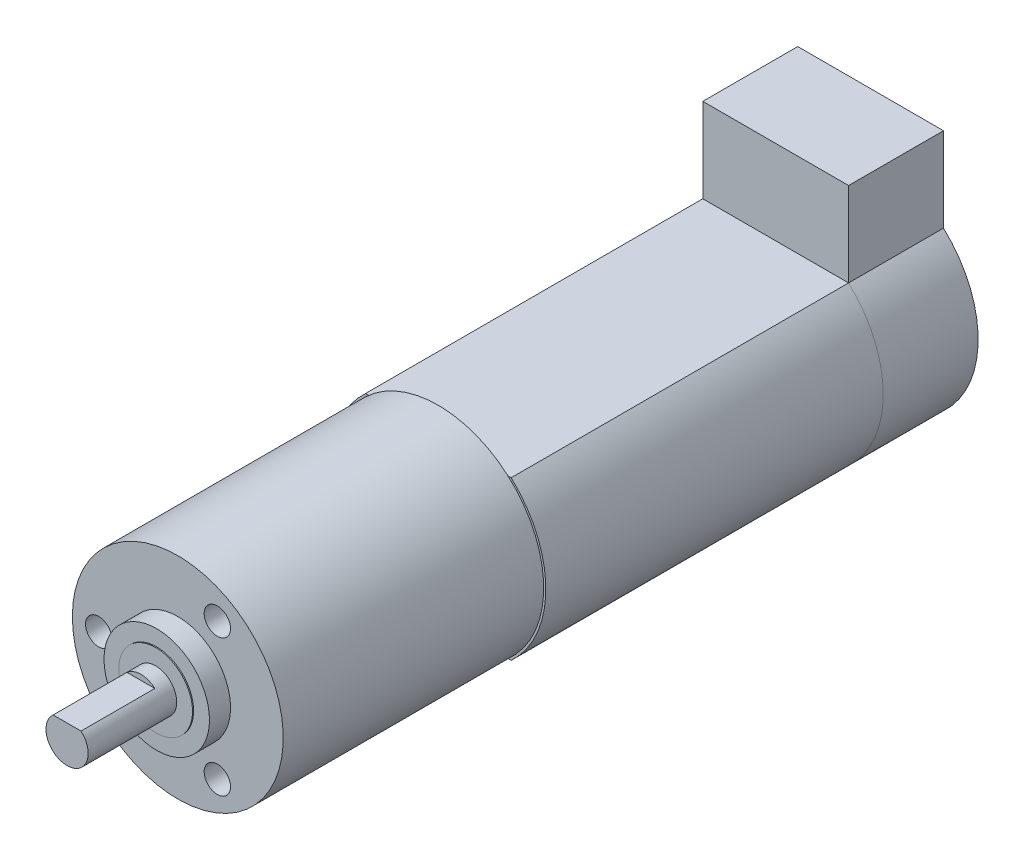
from build123d import *

# Parameters (mm, degrees)
BOSS_EXTRUDE1_DEPTH = 7
SKETCH2_R           = 2
BOSS_EXTRUDE2_DEPTH = 1.4
SKETCH3_R           = 3.5
BOSS_EXTRUDE3_DEPTH = 0.1
SKETCH4_R           = 5
BOSS_EXTRUDE4_DEPTH = 2
SKETCH5_R           = 10
BOSS_EXTRUDE5_DEPTH = 24.7
SKETCH6_R           = 1.25
SCREW_HOLES_DEPTH   = 5
MOTOR_DEPTH         = 32
ENCODER_DEPTH       = 9


with BuildPart() as part:
    # Sketch1 → Boss-Extrude1 (new body)
    with BuildSketch(Plane.XY):
        with BuildLine():
            Line((-1.322875656, 1.5), (1.322875656, 1.5))
            ThreePointArc((1.322875656, 1.5), (0, -2), (-1.322875656, 1.5))
        make_face()
    extrude(amount=-BOSS_EXTRUDE1_DEPTH)

    # Sketch2 → Boss-Extrude2 (add)
    with BuildSketch(Plane(origin=(0, 0, -7), x_dir=(-1, 0, 0), z_dir=(0, 0, -1))):
        Circle(SKETCH2_R)
    extrude(amount=BOSS_EXTRUDE2_DEPTH)

    # Sketch3 → Boss-Extrude3 (add)
    with BuildSketch(Plane(origin=(0, 0, -8.4), x_dir=(-1, 0, 0), z_dir=(0, 0, -1))):
        Circle(SKETCH3_R)
    extrude(amount=BOSS_EXTRUDE3_DEPTH)


with BuildPart() as body_2:
    # Sketch4 → Boss-Extrude4 (new body)
    with BuildSketch(Plane(origin=(0, 0, -8.5), x_dir=(-1, 0, 0), z_dir=(0, 0, -1))):
        Circle(SKETCH4_R)
    extrude(amount=BOSS_EXTRUDE4_DEPTH)

    # Sketch5 → Boss-Extrude5 (add)
    with BuildSketch(Plane(origin=(0, 0, -10.5), x_dir=(-1, 0, 0), z_dir=(0, 0, -1))):
        Circle(SKETCH5_R)
    extrude(amount=BOSS_EXTRUDE5_DEPTH)

    # Sketch6 → Screw Holes (cut)
    with BuildSketch(Plane.XY.offset(-10.5)):
        with Locations((3.75, 6.495190528)):
            Circle(SKETCH6_R)
        with Locations((3.75, -6.495190528)):
            Circle(SKETCH6_R)
        with Locations((-7.5, 0)):
            Circle(SKETCH6_R)
    extrude(amount=-SCREW_HOLES_DEPTH, mode=Mode.SUBTRACT)


with BuildPart() as body_3:
    # Sketch10 → Motor (new body)
    with BuildSketch(Plane(origin=(0, 0, -35.2), x_dir=(-1, 0, 0), z_dir=(0, 0, -1))):
        with BuildLine():
            Line((-6.913031173, 7.5), (6.913031173, 7.5))
            ThreePointArc((6.913031173, 7.5), (10.2, 0), (6.913031173, -7.5))
            Line((6.913031173, -7.5), (-6.913031173, -7.5))
            ThreePointArc((-6.913031173, -7.5), (-10.2, 0), (-6.913031173, 7.5))
        make_face()
    extrude(amount=MOTOR_DEPTH)


with BuildPart() as body_4:
    # Sketch11 → Encoder (new body)
    with BuildSketch(Plane(origin=(0, 0, -67.2), x_dir=(-1, 0, 0), z_dir=(0, 0, -1))):
        with BuildLine():
            Line((-6.913031173, -7.5), (6.913031173, -7.5))
            ThreePointArc((6.913031173, -7.5), (10.2, 0), (6.913031173, 7.5))
            Line((6.913031173, 7.5), (6.913031173, 15.5))
            Line((6.913031173, 15.5), (-6.913031173, 15.5))
            Line((-6.913031173, 15.5), (-6.913031173, 7.5))
            ThreePointArc((-6.913031173, 7.5), (-10.2, 0), (-6.913031173, -7.5))
        make_face()
    extrude(amount=ENCODER_DEPTH)


solid = Compound([part.part, body_2.part, body_3.part, body_4.part])
